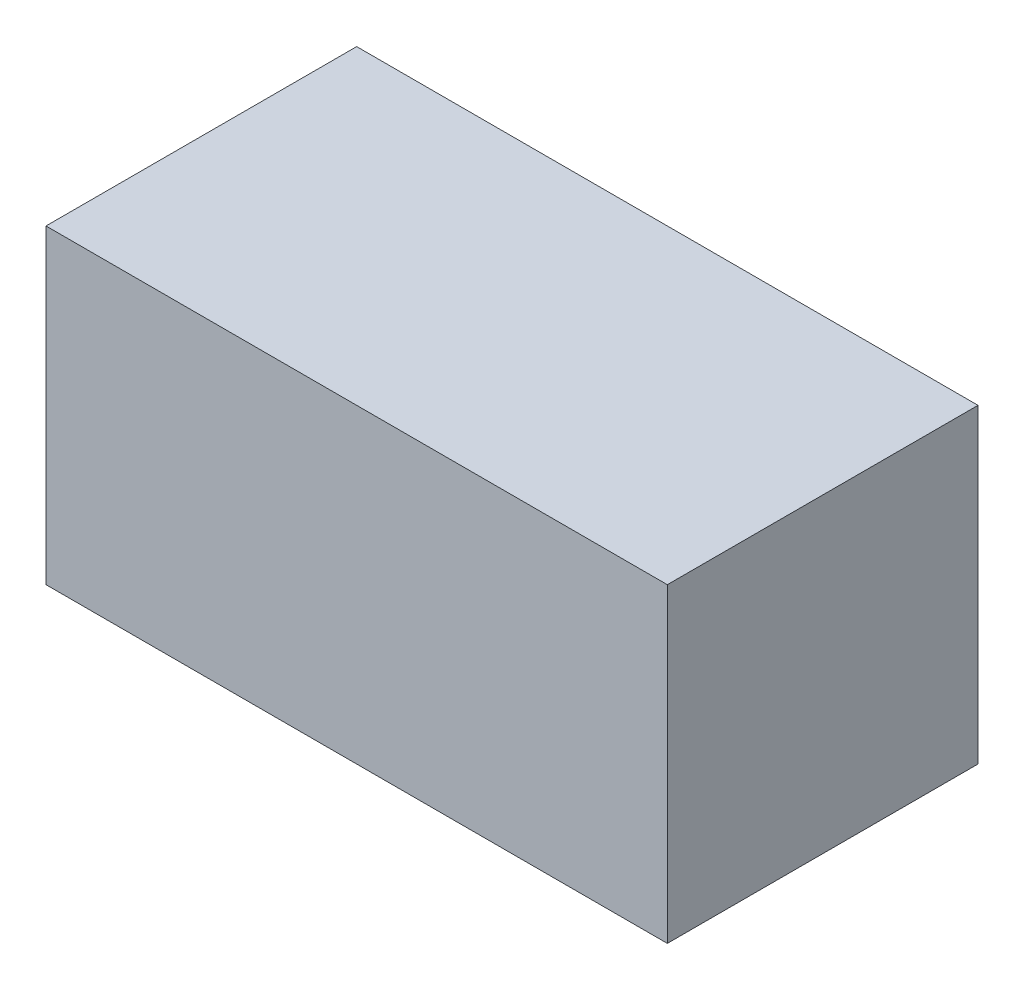
from build123d import *

# Parameters (mm, degrees)
SKETCH_1_W      = 2
SKETCH_1_H      = 1
EXTRUDE_1_DEPTH = 1


with BuildPart() as part:
    # 草图1 → 凸台-拉伸1 (new body)
    with BuildSketch(Plane.XY):
        with Locations((0.95, -1.2)):
            Rectangle(SKETCH_1_W, SKETCH_1_H)
    extrude(amount=EXTRUDE_1_DEPTH)


solid = part.part
